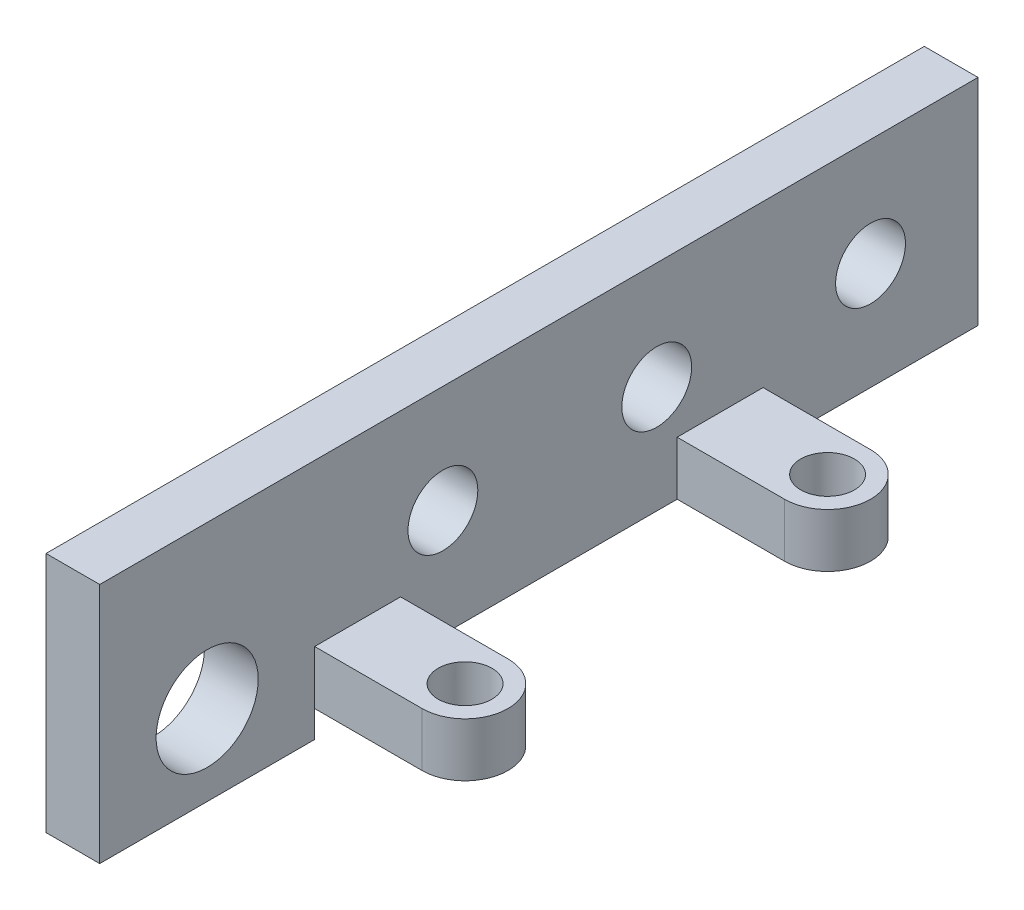
from build123d import *

# Parameters (mm, degrees)
SKETCH1_R           = 3.25
SKETCH1_R_2         = 4.75
BOSS_EXTRUDE1_DEPTH = 5
SKETCH2_W           = 8
SKETCH2_H           = 5
BOSS_EXTRUDE2_DEPTH = 10
BOSS_EXTRUDE3_DEPTH = 5
SKETCH3_6_R         = 2.5
CUT_EXTRUDE2_DEPTH  = 86.246726341


with BuildPart() as part:
    # Sketch1 → Boss-Extrude1 (new body)
    with BuildSketch(Plane(origin=(0, 0, 0), x_dir=(0, 0, -1), z_dir=(1, 0, 0))):
        Polygon((-61.737410968, -2.5), (-61.737410968, 0), (0, 0), (0, 20), (-81.737410968, 20), (-81.737410968, -2.5), align=None)
        with Locations((-10, 10)):
            Circle(SKETCH1_R, mode=Mode.SUBTRACT)
        with Locations((-71.737410968, 5)):
            Circle(SKETCH1_R_2, mode=Mode.SUBTRACT)
        with Locations((-49.8, 10)):
            Circle(SKETCH1_R, mode=Mode.SUBTRACT)
        with Locations((-29.9, 10)):
            Circle(SKETCH1_R, mode=Mode.SUBTRACT)
    extrude(amount=BOSS_EXTRUDE1_DEPTH)

    # Sketch2 → Boss-Extrude2 (add)
    with BuildSketch(Plane(origin=(5, 0, 0), x_dir=(0, 0, -1), z_dir=(1, 0, 0))):
        with Locations((-57.737410968, 2.5)):
            Rectangle(SKETCH2_W, SKETCH2_H)
        with Locations((-24, 2.5)):
            Rectangle(SKETCH2_W, SKETCH2_H)
    extrude(amount=BOSS_EXTRUDE2_DEPTH)

    # Sketch3 → Boss-Extrude3 (add)
    with BuildSketch(Plane(origin=(0, 5, 0), x_dir=(1, 0, 0), z_dir=(0, 1, 0))):
        with BuildLine():
            Line((15, -53.737410968), (15, -61.737410968))
            ThreePointArc((15, -61.737410968), (19, -57.737410968), (15, -53.737410968))
        make_face()
    boss_extrude3 = extrude(amount=-BOSS_EXTRUDE3_DEPTH)

    # Sketch3<6> → Cut-Extrude2 (cut, through all)
    with BuildSketch(Plane(origin=(0, 5, 0), x_dir=(1, 0, 0), z_dir=(0, 1, 0))):
        with Locations((15, -57.737410968)):
            Circle(SKETCH3_6_R)
    cut_extrude2 = extrude(amount=-CUT_EXTRUDE2_DEPTH, mode=Mode.SUBTRACT)

    # Mirror1: Boss-Extrude3, Cut-Extrude2 across plane
    add(boss_extrude3.mirror(Plane.XY.offset(40.868705484)))
    add(cut_extrude2.mirror(Plane.XY.offset(40.868705484)), mode=Mode.SUBTRACT)


solid = part.part
